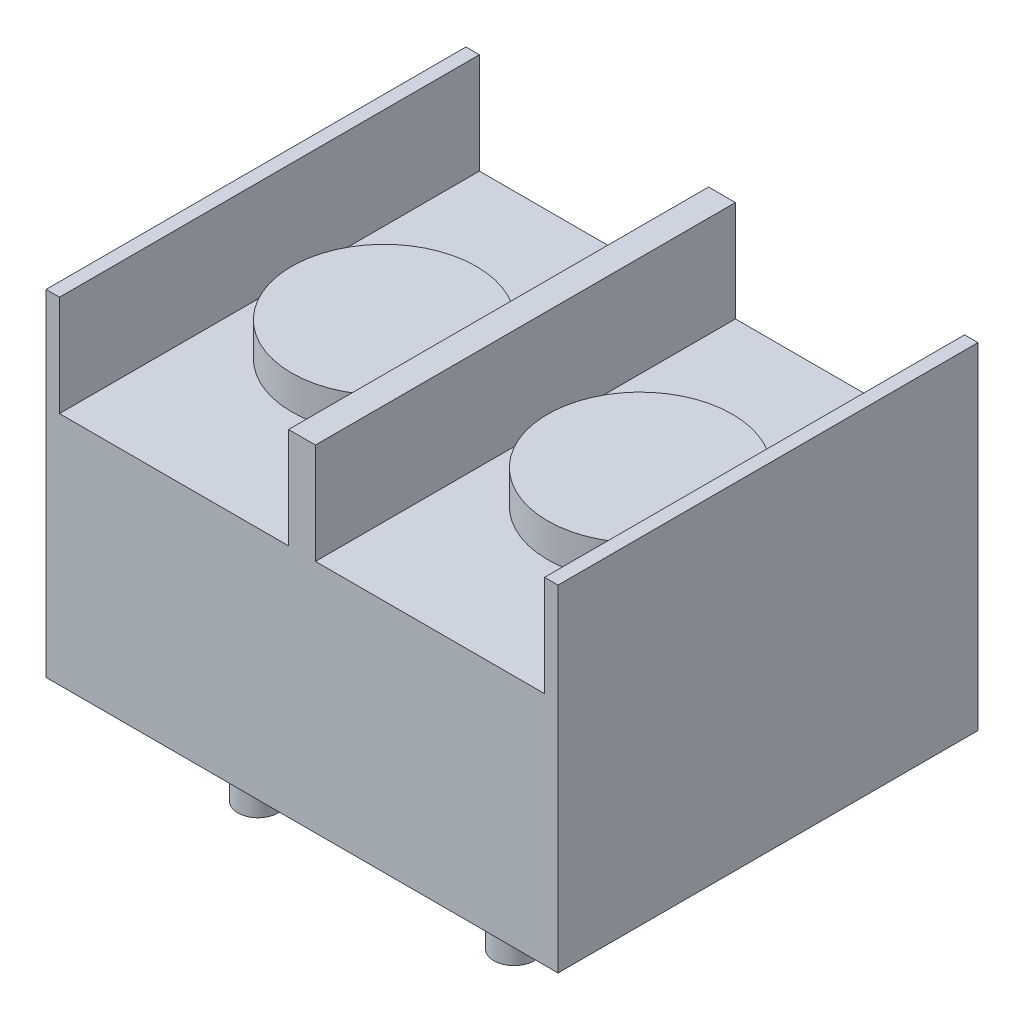
from build123d import *

# Parameters (mm, degrees)
SKETCH_1_W          = 15.24
SKETCH_1_H          = 12.5
EXTRUDE_1_DEPTH     = 10
SKETCH_2_W          = 6.82
SKETCH_2_H          = 12.5
CUT_EXTRUDE_1_DEPTH = 3
SKETCH_3_R          = 0.6
EXTRUDE_2_DEPTH     = 2.54
SKETCH_4_R          = 2.75
EXTRUDE_3_DEPTH     = 1


with BuildPart() as part:
    # 草图1 → 拉伸1 (new body)
    with BuildSketch(Plane(origin=(0, 0, 0), x_dir=(1, 0, 0), z_dir=(0, 1, 0))):
        Rectangle(SKETCH_1_W, SKETCH_1_H)
    extrude(amount=EXTRUDE_1_DEPTH)

    # 草图2 → 切除-拉伸1 (cut)
    with BuildSketch(Plane(origin=(0, 10, 0), x_dir=(-1, 0, 0), z_dir=(0, 1, 0))):
        with Locations((3.81, 0)):
            Rectangle(SKETCH_2_W, SKETCH_2_H)
        with Locations((-3.81, 0)):
            Rectangle(SKETCH_2_W, SKETCH_2_H)
    extrude(amount=-CUT_EXTRUDE_1_DEPTH, mode=Mode.SUBTRACT)

    # 草图3 → 拉伸2 (add)
    with BuildSketch(Plane.XZ):
        with Locations((3.81, 3.75)):
            Circle(SKETCH_3_R)
        with Locations((-3.81, 3.75)):
            Circle(SKETCH_3_R)
    extrude(amount=EXTRUDE_2_DEPTH)

    # 草图4 → 拉伸3 (add)
    with BuildSketch(Plane(origin=(0, 7, 0), x_dir=(-1, 0, 0), z_dir=(0, 1, 0))):
        with Locations((-3.81, 0)):
            Circle(SKETCH_4_R)
        with Locations((3.81, 0)):
            Circle(SKETCH_4_R)
    extrude(amount=EXTRUDE_3_DEPTH)


solid = part.part
